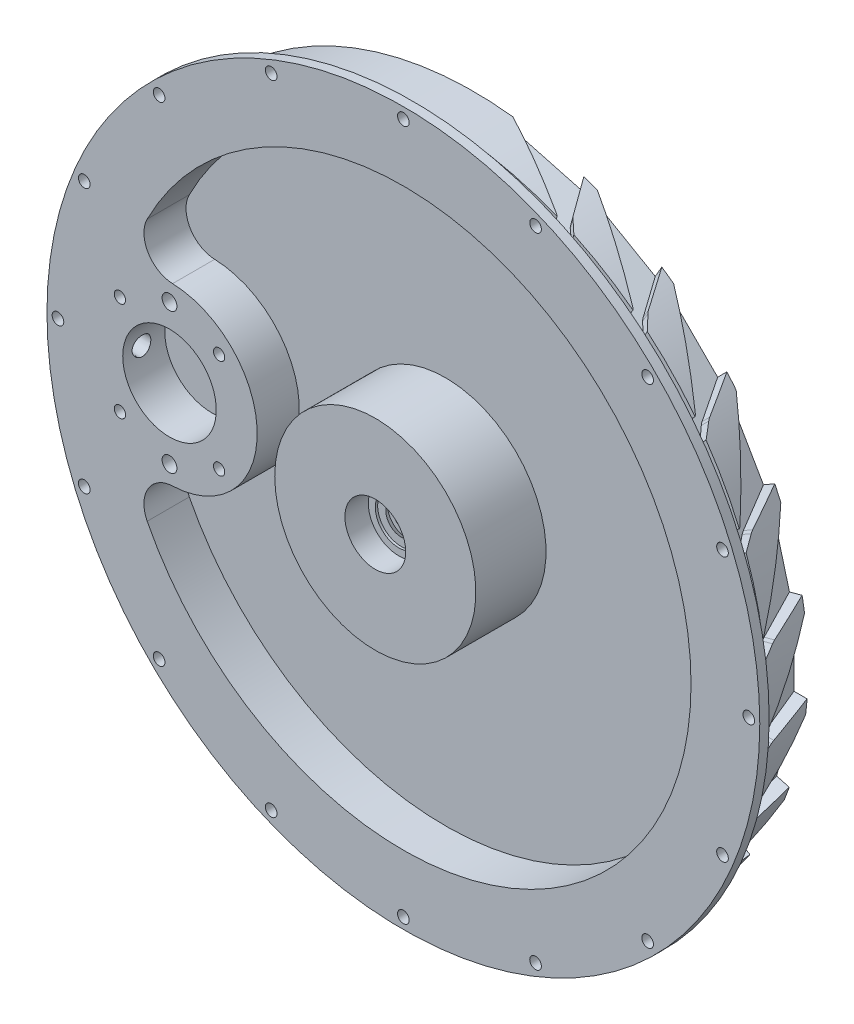
from build123d import *

# Parameters (mm, degrees)
BOSS_EXTRUDE1_START             = 12
SKETCH3_R                       = 20
BOSS_EXTRUDE1_DEPTH             = 18
CUT_EXTRUDE6_START              = 22
SKETCH3_3_R                     = 3.175
SKETCH3_3_R_2                   = 2.413
CUT_EXTRUDE6_DEPTH              = 8
FILLET1_R                       = 12.7
CUT_EXTRUDE3_START              = 137
CUT_EXTRUDE3_DEPTH              = 83.580327126
CIRPATTERN1_COUNT               = 6
CIRPATTERN1_ANGLE               = 75
CIRPATTERN1_THE_OTHER_WAY_COUNT = 6
CIRPATTERN1_THE_OTHER_WAY_ANGLE = 75
CUT_EXTRUDE4_REACH              = 221.58
CUT_EXTRUDE4_END_RADIUS         = 43
SKETCH1_4_R                     = 3.175
CUT_EXTRUDE5_START              = -127.000000105
CUT_EXTRUDE5_DEPTH              = 7.404079955
SKETCH1_10_W                    = 2.4892
SKETCH1_10_H                    = 4
CIRPATTERN2_COUNT               = 16


# Read off the part's stored shape, not the designer's step: Cut-Extrude5
with BuildPart() as part:
    # Sketch1 → Revolve1 (revolve)
    with BuildSketch(Plane.YZ, mode=Mode.PRIVATE) as revolve1_sk:
        Polygon((143, 18), (127, 18), (127, 26), (152.4, 26), (152.4, 30), (123, 30), (123, 12), (43, 12), (43, 42), (13, 42), (13, 32), (10, 32), (10, 31), (6.5, 31), (8.5, 28.333333333), (6.5, 28.333333333), (8.5, 25.666666667), (6.5, 25.666666667), (8.5, 23), (14.986, 23), (14.986, 8), (107, 8), (107, 0), (143, 0), align=None)
    revolve(revolve1_sk.sketch.rotate(Axis((0, 0, 0), (0, 0, 1)), 90), axis=Axis((0, 0, 0), (0, 0, 1)))

    # Sketch3 → Boss-Extrude1 (add)
    with BuildSketch(Plane(origin=(0, 0, 0), x_dir=(0, 1, 0), z_dir=(0, 0, 1)).offset(BOSS_EXTRUDE1_START)):
        with BuildLine():
            Line((-37.5, 117.144141979), (-37.5, 100))
            ThreePointArc((-37.5, 100), (0, 62.5), (37.5, 100))
            Line((37.5, 100), (37.5, 117.144141979))
            ThreePointArc((37.5, 117.144141979), (0, 123), (-37.5, 117.144141979))
        make_face()
        with Locations(Location((0, 100, 0), (0, 0, 90))):
            Circle(SKETCH3_R, mode=Mode.SUBTRACT)
    extrude(amount=BOSS_EXTRUDE1_DEPTH)

    # Sketch3<3> → Cut-Extrude6 (cut)
    with BuildSketch(Plane(origin=(0, 0, 0), x_dir=(0, 1, 0), z_dir=(0, 0, 1)).offset(CUT_EXTRUDE6_START)):
        with Locations(Location((-30, 100, 0), (0, 0, 90))):
            Circle(SKETCH3_3_R)
        with Locations(Location((-21.213203436, 78.786796564, 0), (0, 0, 90))):
            Circle(SKETCH3_3_R_2)
        with Locations(Location((21.213203436, 78.786796564, 0), (0, 0, 90))):
            Circle(SKETCH3_3_R_2)
        with Locations(Location((30, 100, 0), (0, 0, 90))):
            Circle(SKETCH3_3_R)
        with Locations(Location((21.213203436, 121.213203436, 0), (0, 0, 90))):
            Circle(SKETCH3_3_R_2)
        with Locations(Location((-21.213203436, 121.213203436, 0), (0, 0, 90))):
            Circle(SKETCH3_3_R_2)
    extrude(amount=CUT_EXTRUDE6_DEPTH, mode=Mode.SUBTRACT)

    # Fillet1
    fillet1_edges = [part.edges().sort_by_distance(p)[0] for p in [
        (-117.144141979, -37.5, 21),
        (-117.144141979, 37.5, 21),
    ]]
    fillet(fillet1_edges, radius=FILLET1_R)

    # Sketch2 → Cut-Extrude3 (cut, through all)
    with BuildSketch(Plane.YZ.offset(CUT_EXTRUDE3_START)):
        with BuildLine():
            ThreePointArc((-20.776193148, 14.169777784), (-20.305650342, 13.719585278), (-19.897608686, 13.212056135))
            Line((-19.897608686, 13.212056135), (-10.624198796, 0))
            Line((-10.624198796, 0), (20.526738158, 0))
            Line((20.526738158, 0), (-16.466518803, 17.301069829))
            ThreePointArc((-16.466518803, 17.301069829), (-17.037193128, 17.614780905), (-17.5622551, 18))
            Line((-17.5622551, 18), (-25.340874234, 18))
            Line((-25.340874234, 18), (-20.776193148, 14.169777784))
        make_face()
    cut_extrude3 = extrude(amount=CUT_EXTRUDE3_DEPTH, mode=Mode.SUBTRACT)

    # CirPattern1: Cut-Extrude3 ×6 about axis
    cirpattern1_axis = Axis((0, 0, 0), (0, 0, -1))
    for i in range(1, CIRPATTERN1_COUNT):
        add(cut_extrude3.rotate(cirpattern1_axis, i * CIRPATTERN1_ANGLE / (CIRPATTERN1_COUNT - 1)), mode=Mode.SUBTRACT)

    # CirPattern1 the other way: Cut-Extrude3 ×6 about axis
    cirpattern1_the_other_way_axis = Axis((0, 0, 0), (0, 0, 1))
    for i in range(1, CIRPATTERN1_THE_OTHER_WAY_COUNT):
        add(cut_extrude3.rotate(cirpattern1_the_other_way_axis, i * CIRPATTERN1_THE_OTHER_WAY_ANGLE / (CIRPATTERN1_THE_OTHER_WAY_COUNT - 1)), mode=Mode.SUBTRACT)

    # Cut-Extrude4: up to this cylinder (the profile starts inside it)
    cut_extrude4_end = Plane(origin=(0, 0, 19.825), z_dir=(0, 0, -1)) * Cylinder(CUT_EXTRUDE4_END_RADIUS, 530.16, mode=Mode.PRIVATE)
    # Sketch1<4> → Cut-Extrude4 (cut, up to the surface)
    with BuildSketch(Plane.YZ, mode=Mode.PRIVATE) as cut_extrude4_sk1:
        with Locations(Location((0, 19.825, 0), (0, 0, 270))):
            Circle(SKETCH1_4_R)
    cut_extrude4_tool1 = extrude(cut_extrude4_sk1.sketch, amount=-CUT_EXTRUDE4_REACH, mode=Mode.PRIVATE) & cut_extrude4_end
    add(cut_extrude4_tool1.solids().sort_by_distance((0, 0, 19.825))[0], mode=Mode.SUBTRACT)

    # Cut-Extrude5 outline → Cut-Extrude5 (cut)
    with BuildSketch(Plane.YZ.offset(CUT_EXTRUDE5_START)):
        with BuildLine():
            add(Edge.make_bspline(
                [(0, 18), (1.059898446, 18), (2.093043552, 18.435967843), (3.564662034, 19.908029372), (3.999376392, 20.951233385), (4.00062219, 23.044004327), (3.57241143, 24.084112066), (2.085700368, 25.571484356), (1.047192808, 25.999575976), (-1.043950981, 26.000423367), (-2.087877768, 25.567696167), (-3.564072022, 24.094058294), (-3.999253239, 23.059357236), (-4.000744768, 20.946289638), (-3.565344782, 19.9095889), (-2.095726525, 18.437777054), (-1.059898446, 18), (0, 18)],
                knots=[0, 0, 0, 0, 0.125, 0.125, 0.25, 0.25, 0.375, 0.375, 0.5, 0.5, 0.625, 0.625, 0.75, 0.75, 0.875, 0.875, 1, 1, 1, 1], degree=3))
        make_face()
    extrude(amount=CUT_EXTRUDE5_DEPTH, mode=Mode.SUBTRACT)

    # Sketch1<10> → Cut-Revolve2 (revolve, cut)
    with BuildSketch(Plane.YZ, mode=Mode.PRIVATE) as cut_revolve2_sk:
        with Locations((148.9446, 28)):
            Rectangle(SKETCH1_10_W, SKETCH1_10_H)
    cut_revolve2 = revolve(cut_revolve2_sk.sketch.rotate(Axis((0, 147.7, 26), (0, 0, 1)), 90), axis=Axis((0, 147.7, 26), (0, 0, 1)), mode=Mode.SUBTRACT)

    # CirPattern2: Cut-Revolve2 ×16 about axis
    cirpattern2_axis = Axis((0, 0, 0), (0, 0, 1))
    for i in range(1, CIRPATTERN2_COUNT):
        add(cut_revolve2.rotate(cirpattern2_axis, i * 360 / CIRPATTERN2_COUNT), mode=Mode.SUBTRACT)


solid = part.part
